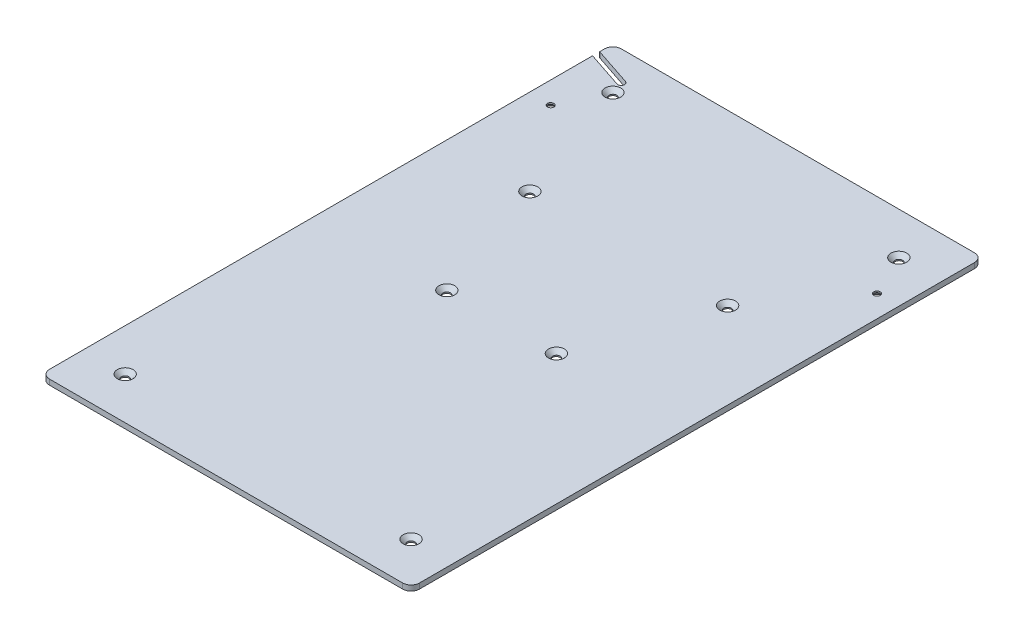
from build123d import *

# Parameters (mm, degrees)
SKETCH1_W                                      = 220
SKETCH1_H                                      = 340
BOSS_EXTRUDE1_DEPTH                            = 3.175
FILLET1_R                                      = 5
CSK_FOR_6_FLAT_HEAD_SOCKET_CAP_SCREW1_A_COUNT  = 2
CSK_FOR_6_FLAT_HEAD_SOCKET_CAP_SCREW1_A_PITCH  = 194
CSK_FOR_M4_FLAT_HEAD_MACHINE_SCREW1_AT_2_COUNT = 2
CSK_FOR_M4_FLAT_HEAD_MACHINE_SCREW1_AT_2_PITCH = 148.413565465
CSK_FOR_M4_FLAT_HEAD_MACHINE_SCREW1_AT_3_COUNT = 2
CSK_FOR_M4_FLAT_HEAD_MACHINE_SCREW1_AT_3_PITCH = 216.016881764
CSK_FOR_M4_FLAT_HEAD_MACHINE_SCREW1_AT_4_COUNT = 2
CSK_FOR_M4_FLAT_HEAD_MACHINE_SCREW1_AT_4_PITCH = 290
CUT_EXTRUDE1_DEPTH                             = 203.509458112


with BuildPart() as part:
    # Sketch1 → Boss-Extrude1 (new body)
    with BuildSketch(Plane(origin=(0, 0, 0), x_dir=(1, 0, 0), z_dir=(0, 1, 0))):
        Rectangle(SKETCH1_W, SKETCH1_H)
    extrude(amount=BOSS_EXTRUDE1_DEPTH)

    # Fillet1
    fillet1_edges = [part.edges().sort_by_distance(p)[0] for p in [
        (110, 1.5875, -170),
        (-110, 1.5875, -170),
        (-110, 1.5875, 170),
        (110, 1.5875, 170),
    ]]
    fillet(fillet1_edges, radius=FILLET1_R)

    # Sketch4 → CSK for #6 Flat Head Socket Cap Screw1 (revolve, cut)
    with BuildSketch(Plane(origin=(97, 0, -120), x_dir=(0, 0, -1), z_dir=(1, 0, 0))):
        Polygon((0, 0), (0, 3.175), (1.89865, 3.175), (1.89865, 2.301024407), (3.8989, 0), align=None)
    csk_for_6_flat_head_socket_cap_screw1 = revolve(axis=Axis((97, -6.35, -120), (0, 1, 0)), mode=Mode.SUBTRACT)

    # CSK for #6 Flat Head Socket Cap Screw1 a: CSK for #6 Flat Head Socket Cap Screw1 ×2
    with Locations(*[(-i * CSK_FOR_6_FLAT_HEAD_SOCKET_CAP_SCREW1_A_PITCH, 0, 0) for i in range(1, CSK_FOR_6_FLAT_HEAD_SOCKET_CAP_SCREW1_A_COUNT)]):
        add(csk_for_6_flat_head_socket_cap_screw1, mode=Mode.SUBTRACT)

    # Sketch5 → CSK for M4 Flat Head Machine Screw1 (revolve, cut)
    with BuildSketch(Plane(origin=(-85, 3.175, 145), x_dir=(0, 0, 1), z_dir=(1, 0, 0))):
        Polygon((0, 0), (0, 3.175), (2.25, 3.175), (2.25, 2.45), (4.7, 0), align=None)
    csk_for_m4_flat_head_machine_screw1 = revolve(axis=Axis((-85, 9.525, 145), (0, -1, 0)), mode=Mode.SUBTRACT)

    # CSK for M4 Flat Head Machine Screw1 at 2: CSK for M4 Flat Head Machine Screw1 ×2
    with Locations(*[Vector(0.35336144759203464, 0, -0.9354868718243254) * (i * CSK_FOR_M4_FLAT_HEAD_MACHINE_SCREW1_AT_2_PITCH) for i in range(1, CSK_FOR_M4_FLAT_HEAD_MACHINE_SCREW1_AT_2_COUNT)]):
        add(csk_for_m4_flat_head_machine_screw1, mode=Mode.SUBTRACT)

    # CSK for M4 Flat Head Machine Screw1 at 3: CSK for M4 Flat Head Machine Screw1 ×2
    with Locations(*[Vector(0.12138780984794917, 0, -0.9926051579658037) * (i * CSK_FOR_M4_FLAT_HEAD_MACHINE_SCREW1_AT_3_PITCH) for i in range(1, CSK_FOR_M4_FLAT_HEAD_MACHINE_SCREW1_AT_3_COUNT)]):
        add(csk_for_m4_flat_head_machine_screw1, mode=Mode.SUBTRACT)

    # CSK for M4 Flat Head Machine Screw1 at 4: CSK for M4 Flat Head Machine Screw1 ×2
    with Locations(*[(0, 0, -i * CSK_FOR_M4_FLAT_HEAD_MACHINE_SCREW1_AT_4_PITCH) for i in range(1, CSK_FOR_M4_FLAT_HEAD_MACHINE_SCREW1_AT_4_COUNT)]):
        add(csk_for_m4_flat_head_machine_screw1, mode=Mode.SUBTRACT)

    # Mirror1: CSK for M4 Flat Head Machine Screw1 across plane
    add(csk_for_m4_flat_head_machine_screw1.mirror(Plane(origin=(0, 0, 0), x_dir=(0, 0, 1), z_dir=(1, 0, 0))), mode=Mode.SUBTRACT)

    # Mirror1 copy 1 sketch → Mirror1 copy 1 (revolve, cut)
    with BuildSketch(Plane(origin=(32.556367665, 3.175, 6.161057907), x_dir=(0, 0, 1), z_dir=(-1, 0, 0))):
        Polygon((0, 0), (0, -3.175), (2.25, -3.175), (2.25, -2.45), (4.7, 0), align=None)
    revolve(axis=Axis((32.556367665, 9.525, 6.161057907), (0, 1, 0)), mode=Mode.SUBTRACT)

    # Mirror1 copy 2 sketch → Mirror1 copy 2 (revolve, cut)
    with BuildSketch(Plane(origin=(58.778183832, 3.175, -69.419471047), x_dir=(0, 0, 1), z_dir=(-1, 0, 0))):
        Polygon((0, 0), (0, -3.175), (2.25, -3.175), (2.25, -2.45), (4.7, 0), align=None)
    revolve(axis=Axis((58.778183832, 9.525, -69.419471047), (0, 1, 0)), mode=Mode.SUBTRACT)

    # Mirror1 copy 3 sketch → Mirror1 copy 3 (revolve, cut)
    with BuildSketch(Plane(origin=(85, 3.175, -145), x_dir=(0, 0, 1), z_dir=(-1, 0, 0))):
        Polygon((0, 0), (0, -3.175), (2.25, -3.175), (2.25, -2.45), (4.7, 0), align=None)
    revolve(axis=Axis((85, 9.525, -145), (0, 1, 0)), mode=Mode.SUBTRACT)

    # Sketch7 → Cut-Extrude1 (cut, through all)
    with BuildSketch(Plane(origin=(0, 3.175, 0), x_dir=(1, 0, 0), z_dir=(0, 1, 0))):
        with BuildLine():
            Line((-109.368867035, 161.89780694), (-86.991048652, 154.455859835))
            ThreePointArc((-86.991048652, 154.455859835), (-85.724374677, 151.926919931), (-88.253314582, 150.660245956))
            Line((-88.253314582, 150.660245956), (-110.631132965, 158.10219306))
            ThreePointArc((-110.631132965, 158.10219306), (-111.89780694, 160.631132965), (-109.368867035, 161.89780694))
        make_face()
    extrude(amount=-CUT_EXTRUDE1_DEPTH, mode=Mode.SUBTRACT)


solid = part.part
